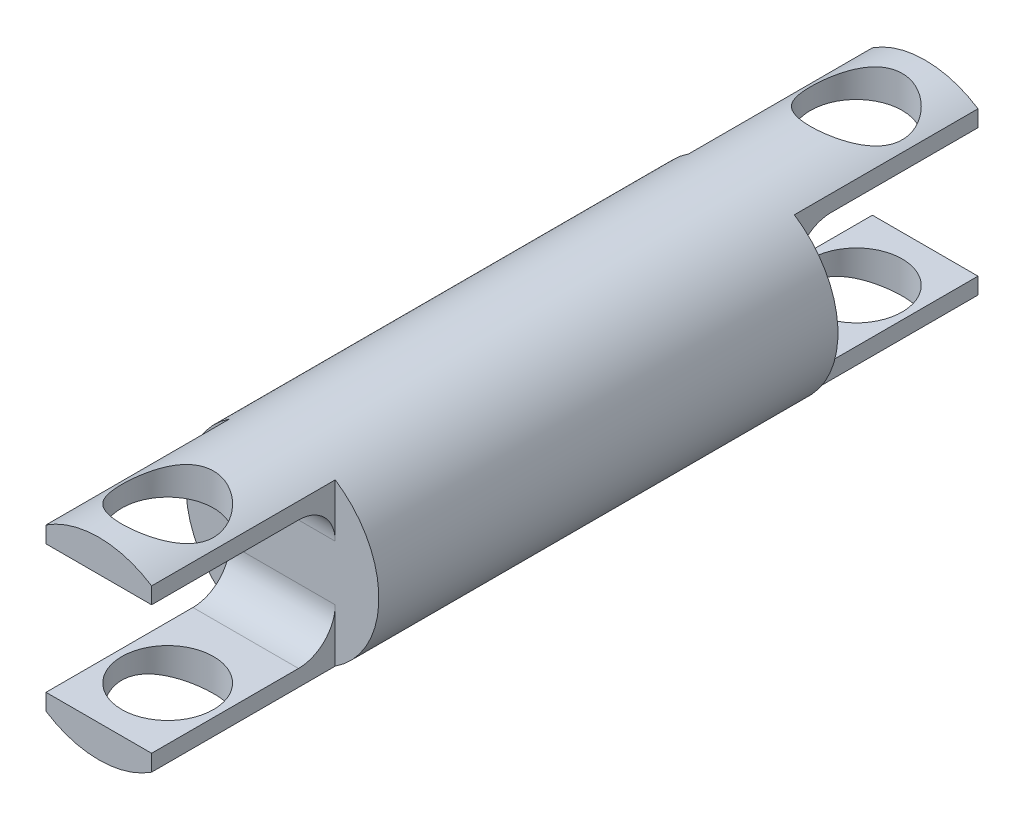
from build123d import *

# Parameters (mm, degrees)
SZKIC1_R                               = 21
DODANIE_WYCI_GNI_CIE1_DEPTH            = 50
DODANIE_WYCI_GNI_CIE4_DEPTH            = 40
SZKIC7_R                               = 10
WYTNIJ_WYCI_GNI_CIE1_DEPTH             = 40
WYTNIJ_WYCI_GNI_CIE1_DIRECTION_2_REACH = 100.823
ZAOKR_GLENIE1_R                        = 8
ZAOKR_GLENIE1_OF_LUSTRO2_R             = 8


with BuildPart() as part:
    # Szkic1 → Dodanie-wyciągnięcie1 (new body)
    with BuildSketch(Plane.XY):
        Circle(SZKIC1_R)
    dodanie_wyci_gni_cie1 = extrude(amount=DODANIE_WYCI_GNI_CIE1_DEPTH)

    # Szkic6 → Dodanie-wyciągnięcie4 (add)
    with BuildSketch(Plane.XY.offset(50)):
        with BuildLine():
            Line((-11.5, 17.571283391), (-11.5, 14))
            Line((-11.5, 14), (11.5, 14))
            Line((11.5, 14), (11.5, 17.571283391))
            ThreePointArc((11.5, 17.571283391), (0, 21), (-11.5, 17.571283391))
        make_face()
        with BuildLine():
            Line((11.5, -14), (11.5, -17.571283391))
            ThreePointArc((11.5, -17.571283391), (0, -21), (-11.5, -17.571283391))
            Line((-11.5, -17.571283391), (-11.5, -14))
            Line((-11.5, -14), (11.5, -14))
        make_face()
    dodanie_wyci_gni_cie4 = extrude(amount=DODANIE_WYCI_GNI_CIE4_DEPTH)

    # Szkic7 → Wytnij-wyciągnięcie1 (cut)
    with BuildSketch(Plane(origin=(0, -14, 0), x_dir=(1, 0, 0), z_dir=(0, 1, 0))):
        with Locations((0, -75)):
            Circle(SZKIC7_R)
    wytnij_wyci_gni_cie1 = extrude(amount=WYTNIJ_WYCI_GNI_CIE1_DEPTH, mode=Mode.SUBTRACT)

    # Szkic7 → Wytnij-wyciągnięcie1 direction 2 (cut, up to next)
    with BuildSketch(Plane(origin=(0, -14, 0), x_dir=(1, 0, 0), z_dir=(0, 1, 0)), mode=Mode.PRIVATE) as wytnij_wyci_gni_cie1_direction_2_sk1:
        with Locations((0, -75)):
            Circle(SZKIC7_R)
    wytnij_wyci_gni_cie1_direction_2_tool1 = extrude(wytnij_wyci_gni_cie1_direction_2_sk1.sketch, amount=-WYTNIJ_WYCI_GNI_CIE1_DIRECTION_2_REACH, mode=Mode.PRIVATE) & part.part
    wytnij_wyci_gni_cie1_direction_2 = wytnij_wyci_gni_cie1_direction_2_tool1.solids().sort_by_distance((0, -14, 75))[0]
    add(wytnij_wyci_gni_cie1_direction_2, mode=Mode.SUBTRACT)

    # Zaokrąglenie1
    zaokr_glenie1_edges = [part.edges().sort_by_distance(p)[0] for p in [
        (0, -14, 50),
        (0, 14, 50),
    ]]
    fillet(zaokr_glenie1_edges, radius=ZAOKR_GLENIE1_R)

    # Lustro2: Dodanie-wyciągnięcie1, Dodanie-wyciągnięcie4, Wytnij-wyciągnięcie1, Wytnij-wyciągnięcie1 direction 2 across plane
    add(dodanie_wyci_gni_cie1.mirror(Plane.XY))
    add(dodanie_wyci_gni_cie4.mirror(Plane.XY))
    add(wytnij_wyci_gni_cie1.mirror(Plane.XY), mode=Mode.SUBTRACT)
    add(wytnij_wyci_gni_cie1_direction_2.mirror(Plane.XY), mode=Mode.SUBTRACT)

    # Zaokrąglenie1 of Lustro2
    zaokr_glenie1_of_lustro2_edges = [part.edges().sort_by_distance(p)[0] for p in [
        (0, -14, -50),
        (0, 14, -50),
    ]]
    fillet(zaokr_glenie1_of_lustro2_edges, radius=ZAOKR_GLENIE1_OF_LUSTRO2_R)


solid = part.part
